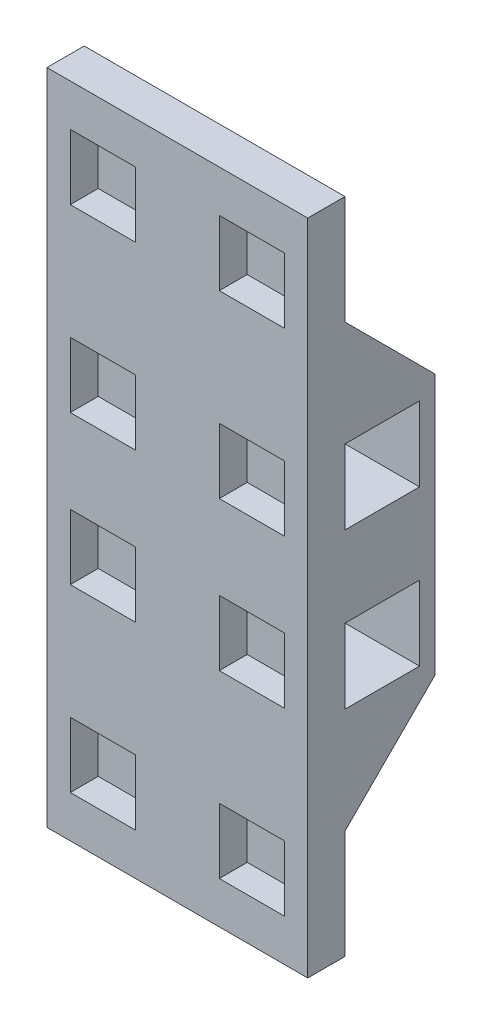
from build123d import *

# Parameters (mm, degrees)
ESQUISSE1_W                  = 42
ESQUISSE1_H                  = 106
BOSS_EXTRU_1_DEPTH           = 6
ESQUISSE2_W                  = 42
ESQUISSE2_H                  = 17
BOSS_EXTRU_3_DEPTH           = 14.5
ESQUISSE3_W                  = 12
ESQUISSE3_H                  = 12
ENL_V_MAT_EXTRU_3_DEPTH      = 87.314830707
ESQUISSE4_R                  = 2
ENL_V_MAT_EXTRU_4_DEPTH      = 42
ESQUISSE5_W                  = 10.5
ESQUISSE5_H                  = 10.5
ENL_V_MAT_EXTRU_5_DEPTH      = 4.5
SYM_TRIE3_COPY_1_SKETCH_W    = 10.5
SYM_TRIE3_COPY_1_SKETCH_H    = 10.5
SYM_TRIE3_COPY_1_DEPTH       = 4.5
SYM_TRIE4_COPY_1_SKETCH_W    = 10.5
SYM_TRIE4_COPY_1_SKETCH_H    = 10.5
SYM_TRIE4_COPY_1_DEPTH       = 4.5
SYM_TRIE5_COPY_1_SKETCH_W    = 10.5
SYM_TRIE5_COPY_1_SKETCH_H    = 10.5
SYM_TRIE5_COPY_1_DEPTH       = 4.5
SYM_TRIE5_COPY_2_SKETCH_W    = 10.5
SYM_TRIE5_COPY_2_SKETCH_H    = 10.5
SYM_TRIE5_COPY_2_DEPTH       = 4.5
SYM_TRIE5_COPY_3_SKETCH_W    = 10.5
SYM_TRIE5_COPY_3_SKETCH_H    = 10.5
SYM_TRIE5_COPY_3_DEPTH       = 4.5
BOSS_EXTRU_4_DEPTH           = 4
BOSS_EXTRU_5_REACH           = 88.315
R_P_TITION_CIRCULAIRE1_COUNT = 2
SYM_TRIE6_COPY_1_DEPTH       = 4
SYM_TRIE6_COPY_2_REACH       = 88.315
ESQUISSE8_W                  = 12
ESQUISSE8_H                  = 8
BOSS_EXTRU_6_DEPTH           = 14.5
CHANFREIN2_SIZE              = 15
CHANFREIN2_SIZE_2            = 8.660254038
SYM_TRIE7_START              = -25
SYM_TRIE7_DEPTH              = 8


# Read off the part's stored shape, not the designer's step: Symétrie7
with BuildPart() as part:
    # Esquisse1 → Boss.-Extru.1 (new body)
    with BuildSketch(Plane.XY):
        with Locations((21, -21)):
            Rectangle(ESQUISSE1_W, ESQUISSE1_H)
    extrude(amount=BOSS_EXTRU_1_DEPTH)

    # Esquisse2 → Boss.-Extru.3 (add)
    with BuildSketch(Plane(origin=(0, 0, 0), x_dir=(-1, 0, 0), z_dir=(0, 0, -1))):
        with Locations((-21, -33.5)):
            Rectangle(ESQUISSE2_W, ESQUISSE2_H)
    boss_extru_3 = extrude(amount=BOSS_EXTRU_3_DEPTH)

    # Esquisse3 → Enlèv. mat.-Extru.3 (cut, through all)
    with BuildSketch(Plane(origin=(42, 0, 0), x_dir=(0, 0, -1), z_dir=(1, 0, 0))):
        with Locations((6, -33.5)):
            Rectangle(ESQUISSE3_W, ESQUISSE3_H)
    enl_v_mat_extru_3 = extrude(amount=-ENL_V_MAT_EXTRU_3_DEPTH, mode=Mode.SUBTRACT)

    # Symétrie1: Boss.-Extru.3, Enlèv. mat.-Extru.3 across plane
    add(boss_extru_3.mirror(Plane(origin=(0, -21, 0), x_dir=(0, 0, 1), z_dir=(0, -1, 0))))
    add(enl_v_mat_extru_3.mirror(Plane(origin=(0, -21, 0), x_dir=(0, 0, 1), z_dir=(0, -1, 0))), mode=Mode.SUBTRACT)

    # Esquisse4 → Enlèv. mat.-Extru.4 (cut)
    with BuildSketch(Plane.XZ.offset(42)):
        with Locations(Location((24.5, -6, 0), (0, 0, 270))):
            Circle(ESQUISSE4_R)
        with Locations(Location((17.5, -6, 0), (0, 0, 270))):
            Circle(ESQUISSE4_R)
    extrude(amount=-ENL_V_MAT_EXTRU_4_DEPTH, mode=Mode.SUBTRACT)

    # Esquisse5 → Enlèv. mat.-Extru.5 (cut)
    with BuildSketch(Plane.XY.offset(6)):
        with Locations((9, -9)):
            Rectangle(ESQUISSE5_W, ESQUISSE5_H)
    enl_v_mat_extru_5 = extrude(amount=-ENL_V_MAT_EXTRU_5_DEPTH, mode=Mode.SUBTRACT)

    # Symétrie2: Enlèv. mat.-Extru.5 across plane
    add(enl_v_mat_extru_5.mirror(Plane(origin=(21, 0, 0), x_dir=(0, 0, 1), z_dir=(1, 0, 0))), mode=Mode.SUBTRACT)

    # Symétrie3: Enlèv. mat.-Extru.5 across plane
    add(enl_v_mat_extru_5.mirror(Plane(origin=(0, -21, 0), x_dir=(0, 0, 1), z_dir=(0, -1, 0))), mode=Mode.SUBTRACT)

    # Symétrie3 copy 1 sketch → Symétrie3 copy 1 (cut)
    with BuildSketch(Plane(origin=(42, -42, 6), x_dir=(-1, 0, 0), z_dir=(0, 0, 1))):
        with Locations((9, -9)):
            Rectangle(SYM_TRIE3_COPY_1_SKETCH_W, SYM_TRIE3_COPY_1_SKETCH_H)
    extrude(amount=-SYM_TRIE3_COPY_1_DEPTH, mode=Mode.SUBTRACT)

    # Symétrie4: Enlèv. mat.-Extru.5 across plane
    add(enl_v_mat_extru_5.mirror(Plane(origin=(0, 5.5, 0), x_dir=(0, 0, 1), z_dir=(0, -1, 0))), mode=Mode.SUBTRACT)

    # Symétrie4 copy 1 sketch → Symétrie4 copy 1 (cut)
    with BuildSketch(Plane(origin=(42, 11, 6), x_dir=(-1, 0, 0), z_dir=(0, 0, 1))):
        with Locations((9, -9)):
            Rectangle(SYM_TRIE4_COPY_1_SKETCH_W, SYM_TRIE4_COPY_1_SKETCH_H)
    extrude(amount=-SYM_TRIE4_COPY_1_DEPTH, mode=Mode.SUBTRACT)

    # Symétrie5 copy 1 sketch → Symétrie5 copy 1 (cut)
    with BuildSketch(Plane(origin=(0, -53, 6), x_dir=(1, 0, 0), z_dir=(0, 0, 1))):
        with Locations((9, -9)):
            Rectangle(SYM_TRIE5_COPY_1_SKETCH_W, SYM_TRIE5_COPY_1_SKETCH_H)
    extrude(amount=-SYM_TRIE5_COPY_1_DEPTH, mode=Mode.SUBTRACT)

    # Symétrie5 copy 2 sketch → Symétrie5 copy 2 (cut)
    with BuildSketch(Plane(origin=(42, -53, 6), x_dir=(-1, 0, 0), z_dir=(0, 0, 1))):
        with Locations((9, 9)):
            Rectangle(SYM_TRIE5_COPY_2_SKETCH_W, SYM_TRIE5_COPY_2_SKETCH_H)
    extrude(amount=-SYM_TRIE5_COPY_2_DEPTH, mode=Mode.SUBTRACT)

    # Symétrie5 copy 3 sketch → Symétrie5 copy 3 (cut)
    with BuildSketch(Plane(origin=(0, -95, 6), x_dir=(1, 0, 0), z_dir=(0, 0, 1))):
        with Locations((9, 9)):
            Rectangle(SYM_TRIE5_COPY_3_SKETCH_W, SYM_TRIE5_COPY_3_SKETCH_H)
    extrude(amount=-SYM_TRIE5_COPY_3_DEPTH, mode=Mode.SUBTRACT)

    # Esquisse6 → Boss.-Extru.4 (add)
    with BuildSketch(Plane.ZY):
        Polygon((-14.5, -42), (0, -56.5), (0, -42), align=None)
    boss_extru_4 = extrude(amount=-BOSS_EXTRU_4_DEPTH)

    # Boss.-Extru.5: up to this face of the body (flat: up to its plane)
    boss_extru_5_end = Plane(part.part.faces().sort_by_distance((2, -49.25, -7.25))[0])
    # Esquisse7 → Boss.-Extru.5 (add, up to the picked face)
    with BuildSketch(Plane(origin=(0, 0, 0), x_dir=(-1, 0, 0), z_dir=(0, 0, -1)), mode=Mode.PRIVATE) as boss_extru_5_sk1:
        Polygon((-4, -56.5), (-12.371578903, -42), (-4, -42), align=None)
    boss_extru_5_tool1 = split(extrude(boss_extru_5_sk1.sketch, amount=BOSS_EXTRU_5_REACH, mode=Mode.PRIVATE), bisect_by=boss_extru_5_end, keep=Keep.BOTH, mode=Mode.PRIVATE)
    boss_extru_5 = boss_extru_5_tool1.solids().sort_by(Axis((6.790526, -46.833333, 0), (0, 0, -1)))[0]
    add(boss_extru_5)

    # Répétition circulaire1: Boss.-Extru.4, Boss.-Extru.5 ×2 about axis
    r_p_tition_circulaire1_axis = Axis((21, -21, 0), (0, 0, 1))
    add([boss_extru_4.rotate(r_p_tition_circulaire1_axis, i * 360 / R_P_TITION_CIRCULAIRE1_COUNT) for i in range(1, R_P_TITION_CIRCULAIRE1_COUNT)])
    add([boss_extru_5.rotate(r_p_tition_circulaire1_axis, i * 360 / R_P_TITION_CIRCULAIRE1_COUNT) for i in range(1, R_P_TITION_CIRCULAIRE1_COUNT)])

    # Symétrie6: Boss.-Extru.4, Boss.-Extru.5 across plane
    add(boss_extru_4.mirror(Plane(origin=(21, 0, 0), x_dir=(0, 0, 1), z_dir=(1, 0, 0))))
    add(boss_extru_5.mirror(Plane(origin=(21, 0, 0), x_dir=(0, 0, 1), z_dir=(1, 0, 0))))

    # Symétrie6 copy 1 sketch → Symétrie6 copy 1 (add)
    with BuildSketch(Plane(origin=(0, -42, 0), x_dir=(0, 0, 1), z_dir=(-1, 0, 0))):
        Polygon((-14.5, 42), (0, 56.5), (0, 42), align=None)
    extrude(amount=-SYM_TRIE6_COPY_1_DEPTH)

    # Symétrie6 copy 2: up to this face of the body (flat: up to its plane)
    sym_trie6_copy_2_end = Plane(part.part.faces().sort_by_distance((2, 7.25, -7.25))[0])
    # Symétrie6 copy 2 sketch → Symétrie6 copy 2 (add, up to the picked face)
    with BuildSketch(Plane(origin=(0, -42, 0), x_dir=(-1, 0, 0), z_dir=(0, 0, -1)), mode=Mode.PRIVATE) as sym_trie6_copy_2_sk1:
        Polygon((-4, 56.5), (-12.371578903, 42), (-4, 42), align=None)
    sym_trie6_copy_2_tool1 = split(extrude(sym_trie6_copy_2_sk1.sketch, amount=SYM_TRIE6_COPY_2_REACH, mode=Mode.PRIVATE), bisect_by=sym_trie6_copy_2_end, keep=Keep.BOTH, mode=Mode.PRIVATE)
    add(sym_trie6_copy_2_tool1.solids().sort_by(Axis((6.790526, 4.833333, 0), (0, 0, -1)))[0])

    # Esquisse8 → Boss.-Extru.6 (add)
    with BuildSketch(Plane(origin=(0, 0, 0), x_dir=(-1, 0, 0), z_dir=(0, 0, -1))):
        with Locations((-6, -21)):
            Rectangle(ESQUISSE8_W, ESQUISSE8_H)
    extrude(amount=BOSS_EXTRU_6_DEPTH)

    # Chanfrein2
    # the kernel refuses this chamfer: 15, 8.660254038 mm, written as the material it adds along each edge
    # the kernel refuses this chamfer: 15, 8.660254038 mm, written as the material it takes off along each edge
    with BuildSketch(Plane(origin=(12, -17, -14.5), x_dir=(0.01932676561270075, 0, 0.9998132206222079), z_dir=(0, -1, 0))) as chanfrein2_2_piece_1_section:
        Polygon((CHANFREIN2_SIZE * 0.999813220622, CHANFREIN2_SIZE * 0.0193267656127), (-CHANFREIN2_SIZE_2 * 0.0193267656124, CHANFREIN2_SIZE_2 * 0.999813220604), (0, 0), align=None)
    chanfrein2_2_piece_1 = extrude(amount=8, mode=Mode.PRIVATE)
    chanfrein2_2_piece_1 = split(chanfrein2_2_piece_1, bisect_by=Plane(origin=(9.590672915, -21, 0), z_dir=(0, 0, -1)), keep=Keep.TOP, mode=Mode.PRIVATE)
    add(chanfrein2_2_piece_1, mode=Mode.SUBTRACT)

    # Symétrie7 outline → Symétrie7 (add)
    with BuildSketch(Plane(origin=(0, 0, 0), x_dir=(1, 0, 0), z_dir=(0, 1, 0)).offset(SYM_TRIE7_START)):
        Polygon((42, 0), (42, 14.5), (38.660254038, 14.5), (30.288675135, 0), align=None)
    extrude(amount=SYM_TRIE7_DEPTH)


solid = part.part
